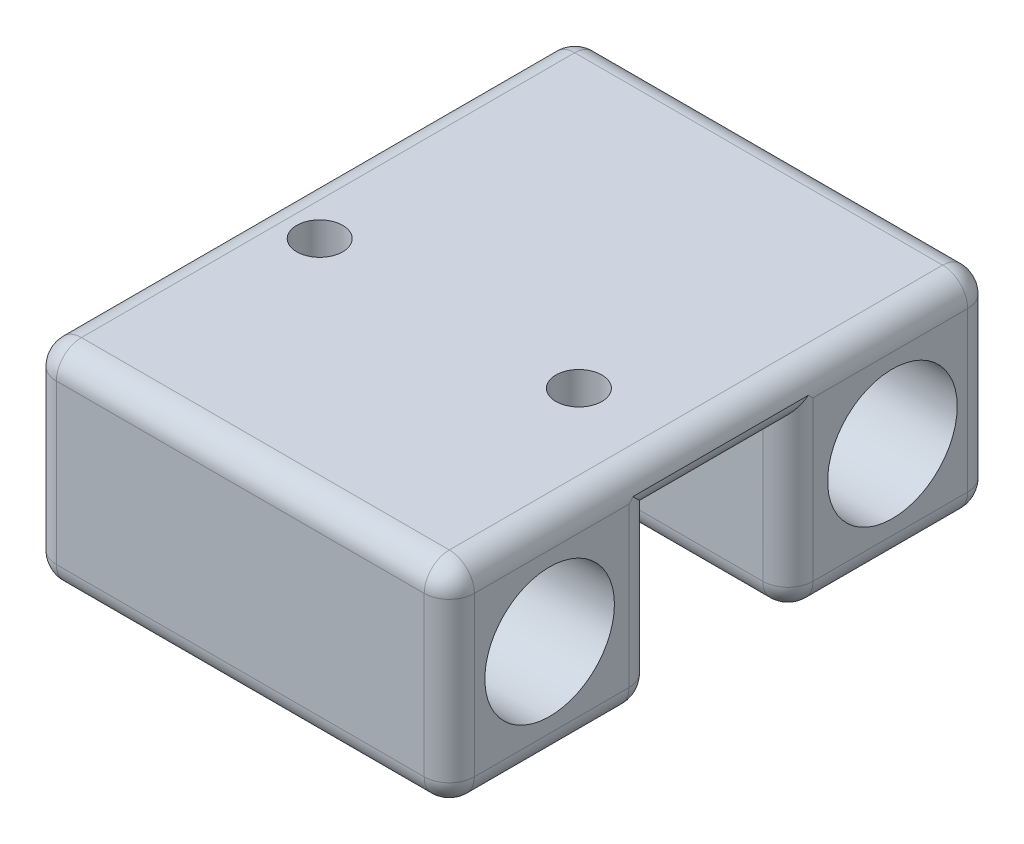
from build123d import *

# Parameters (mm, degrees)
SKETCH_1_W          = 50
SKETCH_1_H          = 65
EXTRUDE_1_DEPTH     = 25
SKETCH_2_R          = 7.75
SKETCH_2_W          = 16
SKETCH_2_H          = 21.892598188
CUT_EXTRUDE_1_DEPTH = 78.172355865
SKETCH_4_R          = 2.75
CUT_EXTRUDE_3_DEPTH = 5
FILLET_1_R          = 3


with BuildPart() as part:
    # 草图1 → 凸台-拉伸1 (new body)
    with BuildSketch(Plane(origin=(0, 0, 0), x_dir=(1, 0, 0), z_dir=(0, 1, 0))):
        with Locations((7.34375, -20.703125)):
            Rectangle(SKETCH_1_W, SKETCH_1_H)
    extrude(amount=EXTRUDE_1_DEPTH)

    # 草图2 → 切除-拉伸1 (cut, through all)
    with BuildSketch(Plane(origin=(32.34375, 0, 0), x_dir=(0, 0, -1), z_dir=(1, 0, 0))):
        with Locations((-41.203125, 12.5)):
            Circle(SKETCH_2_R)
        with Locations((-0.203125, 12.5)):
            Circle(SKETCH_2_R)
        with Locations((-20.703125, 9.053700906)):
            Rectangle(SKETCH_2_W, SKETCH_2_H)
    extrude(amount=-CUT_EXTRUDE_1_DEPTH, mode=Mode.SUBTRACT)

    # 草图4 → 切除-拉伸3 (cut)
    with BuildSketch(Plane(origin=(0, 25, 0), x_dir=(1, 0, 0), z_dir=(0, 1, 0))):
        with Locations(Location((20.34375, -25.703125, 0), (0, 0, 270))):
            Circle(SKETCH_4_R)
        with Locations(Location((-10.65625, -25.703125, 0), (0, 0, 270))):
            Circle(SKETCH_4_R)
    extrude(amount=-CUT_EXTRUDE_3_DEPTH, mode=Mode.SUBTRACT)

    # 圆角1
    # the kernel refuses this fillet: 3 mm, written as the material it takes off along each edge
    with BuildSketch(Plane(origin=(29.34375, 22, -8.796875), x_dir=(1, 0, 0), z_dir=(0, 0, -1))) as fillet_1_piece_1_section:
        Polygon((0, 0), (FILLET_1_R, 0), (FILLET_1_R, -FILLET_1_R), (0, -FILLET_1_R), align=None)
    fillet_1_piece_1 = extrude(amount=FILLET_1_R, mode=Mode.PRIVATE)
    fillet_1_piece_1 = fillet_1_piece_1 - Plane(origin=(29.34375, 22, -8.796875), x_dir=(-0.7071067811865475, -0.7071067811865475, 0), z_dir=(0, 0, -1)) * Sphere(FILLET_1_R, mode=Mode.PRIVATE)
    add(fillet_1_piece_1, mode=Mode.SUBTRACT)
    with BuildSketch(Plane(origin=(29.34375, 22, 50.203125), x_dir=(1, 0, 0), z_dir=(0, 0, 1))) as fillet_1_piece_2_section:
        Polygon((0, 0), (FILLET_1_R, 0), (FILLET_1_R, FILLET_1_R), (0, FILLET_1_R), align=None)
    fillet_1_piece_2 = extrude(amount=FILLET_1_R, mode=Mode.PRIVATE)
    fillet_1_piece_2 = fillet_1_piece_2 - Plane(origin=(29.34375, 22, 50.203125), x_dir=(-0.7071067811865475, -0.7071067811865475, 0), z_dir=(0, 0, 1)) * Sphere(FILLET_1_R, mode=Mode.PRIVATE)
    add(fillet_1_piece_2, mode=Mode.SUBTRACT)
    with BuildSketch(Plane(origin=(-14.65625, 22, -8.796875), x_dir=(-1, 0, 0), z_dir=(0, 0, -1))) as fillet_1_piece_3_section:
        Polygon((0, 0), (FILLET_1_R, 0), (FILLET_1_R, FILLET_1_R), (0, FILLET_1_R), align=None)
    fillet_1_piece_3 = extrude(amount=FILLET_1_R, mode=Mode.PRIVATE)
    fillet_1_piece_3 = fillet_1_piece_3 - Plane(origin=(-14.65625, 22, -8.796875), x_dir=(0.7071067811865475, -0.7071067811865475, 0), z_dir=(0, 0, -1)) * Sphere(FILLET_1_R, mode=Mode.PRIVATE)
    add(fillet_1_piece_3, mode=Mode.SUBTRACT)
    with BuildSketch(Plane(origin=(-14.65625, 3, 50.203125), x_dir=(0, -1, 0), z_dir=(-1, 0, 0))) as fillet_1_piece_4_section:
        Polygon((0, 0), (FILLET_1_R, 0), (FILLET_1_R, FILLET_1_R), (0, FILLET_1_R), align=None)
    fillet_1_piece_4 = extrude(amount=FILLET_1_R, mode=Mode.PRIVATE)
    fillet_1_piece_4 = fillet_1_piece_4 - Plane(origin=(-14.65625, 3, 50.203125), x_dir=(0, 0.7071067811865475, -0.7071067811865475), z_dir=(-1, 0, 0)) * Sphere(FILLET_1_R, mode=Mode.PRIVATE)
    add(fillet_1_piece_4, mode=Mode.SUBTRACT)
    with BuildSketch(Plane(origin=(-14.65625, 3, 31.703125), x_dir=(0, -1, 0), z_dir=(-1, 0, 0))) as fillet_1_piece_5_section:
        Polygon((0, 0), (FILLET_1_R, 0), (FILLET_1_R, -FILLET_1_R), (0, -FILLET_1_R), align=None)
    fillet_1_piece_5 = extrude(amount=FILLET_1_R, mode=Mode.PRIVATE)
    fillet_1_piece_5 = fillet_1_piece_5 - Plane(origin=(-14.65625, 3, 31.703125), x_dir=(0, 0.7071067811865475, 0.7071067811865475), z_dir=(-1, 0, 0)) * Sphere(FILLET_1_R, mode=Mode.PRIVATE)
    add(fillet_1_piece_5, mode=Mode.SUBTRACT)
    with BuildSketch(Plane(origin=(29.34375, 3, -8.796875), x_dir=(1, 0, 0), z_dir=(0, 0, -1))) as fillet_1_piece_6_section:
        Polygon((0, 0), (FILLET_1_R, 0), (FILLET_1_R, FILLET_1_R), (0, FILLET_1_R), align=None)
    fillet_1_piece_6 = extrude(amount=FILLET_1_R, mode=Mode.PRIVATE)
    fillet_1_piece_6 = fillet_1_piece_6 - Plane(origin=(29.34375, 3, -8.796875), x_dir=(-0.7071067811865475, 0.7071067811865475, 0), z_dir=(0, 0, -1)) * Sphere(FILLET_1_R, mode=Mode.PRIVATE)
    add(fillet_1_piece_6, mode=Mode.SUBTRACT)
    with BuildSketch(Plane(origin=(29.34375, 3, 9.703125), x_dir=(1, 0, 0), z_dir=(0, 0, 1))) as fillet_1_piece_7_section:
        Polygon((0, 0), (FILLET_1_R, 0), (FILLET_1_R, -FILLET_1_R), (0, -FILLET_1_R), align=None)
    fillet_1_piece_7 = extrude(amount=FILLET_1_R, mode=Mode.PRIVATE)
    fillet_1_piece_7 = fillet_1_piece_7 - Plane(origin=(29.34375, 3, 9.703125), x_dir=(-0.7071067811865475, 0.7071067811865475, 0), z_dir=(0, 0, 1)) * Sphere(FILLET_1_R, mode=Mode.PRIVATE)
    add(fillet_1_piece_7, mode=Mode.SUBTRACT)
    with BuildSketch(Plane(origin=(29.34375, 3, 31.703125), x_dir=(0, -1, 0), z_dir=(1, 0, 0))) as fillet_1_piece_8_section:
        Polygon((0, 0), (FILLET_1_R, 0), (FILLET_1_R, FILLET_1_R), (0, FILLET_1_R), align=None)
    fillet_1_piece_8 = extrude(amount=FILLET_1_R, mode=Mode.PRIVATE)
    fillet_1_piece_8 = fillet_1_piece_8 - Plane(origin=(29.34375, 3, 31.703125), x_dir=(0, 0.7071067811865475, 0.7071067811865475), z_dir=(1, 0, 0)) * Sphere(FILLET_1_R, mode=Mode.PRIVATE)
    add(fillet_1_piece_8, mode=Mode.SUBTRACT)
    with BuildSketch(Plane(origin=(-14.65625, 3, 9.703125), x_dir=(-1, 0, 0), z_dir=(0, 0, 1))) as fillet_1_piece_9_section:
        Polygon((0, 0), (FILLET_1_R, 0), (FILLET_1_R, FILLET_1_R), (0, FILLET_1_R), align=None)
    fillet_1_piece_9 = extrude(amount=FILLET_1_R, mode=Mode.PRIVATE)
    fillet_1_piece_9 = fillet_1_piece_9 - Plane(origin=(-14.65625, 3, 9.703125), x_dir=(0.7071067811865475, 0.7071067811865475, 0), z_dir=(0, 0, 1)) * Sphere(FILLET_1_R, mode=Mode.PRIVATE)
    add(fillet_1_piece_9, mode=Mode.SUBTRACT)
    with BuildSketch(Plane(origin=(-14.65625, 22, 50.203125), x_dir=(0, 1, 0), z_dir=(-1, 0, 0))) as fillet_1_piece_10_section:
        Polygon((0, 0), (FILLET_1_R, 0), (FILLET_1_R, -FILLET_1_R), (0, -FILLET_1_R), align=None)
    fillet_1_piece_10 = extrude(amount=FILLET_1_R, mode=Mode.PRIVATE)
    fillet_1_piece_10 = fillet_1_piece_10 - Plane(origin=(-14.65625, 22, 50.203125), x_dir=(0, -0.7071067811865475, -0.7071067811865475), z_dir=(-1, 0, 0)) * Sphere(FILLET_1_R, mode=Mode.PRIVATE)
    add(fillet_1_piece_10, mode=Mode.SUBTRACT)
    with BuildSketch(Plane(origin=(-14.65625, 3, -8.796875), x_dir=(-1, 0, 0), z_dir=(0, 0, -1))) as fillet_1_piece_11_section:
        Polygon((0, 0), (FILLET_1_R, 0), (FILLET_1_R, -FILLET_1_R), (0, -FILLET_1_R), align=None)
    fillet_1_piece_11 = extrude(amount=FILLET_1_R, mode=Mode.PRIVATE)
    fillet_1_piece_11 = fillet_1_piece_11 - Plane(origin=(-14.65625, 3, -8.796875), x_dir=(0.7071067811865475, 0.7071067811865475, 0), z_dir=(0, 0, -1)) * Sphere(FILLET_1_R, mode=Mode.PRIVATE)
    add(fillet_1_piece_11, mode=Mode.SUBTRACT)
    with BuildSketch(Plane(origin=(29.34375, 3, 50.203125), x_dir=(1, 0, 0), z_dir=(0, 0, 1))) as fillet_1_piece_12_section:
        Polygon((0, 0), (FILLET_1_R, 0), (FILLET_1_R, -FILLET_1_R), (0, -FILLET_1_R), align=None)
    fillet_1_piece_12 = extrude(amount=FILLET_1_R, mode=Mode.PRIVATE)
    fillet_1_piece_12 = fillet_1_piece_12 - Plane(origin=(29.34375, 3, 50.203125), x_dir=(-0.7071067811865475, 0.7071067811865475, 0), z_dir=(0, 0, 1)) * Sphere(FILLET_1_R, mode=Mode.PRIVATE)
    add(fillet_1_piece_12, mode=Mode.SUBTRACT)
    with BuildSketch(Plane(origin=(32.34375, 25, -8.796875), x_dir=(0, -1, 0), z_dir=(0, 0, 1)), Plane(origin=(-17.65625, 25, 50.203125), x_dir=(0, -1, 0), z_dir=(0, 0, -1))) as fillet_1_piece_13:
        with BuildLine():
            CenterArc((FILLET_1_R, -FILLET_1_R), FILLET_1_R, 90, 90)
            Line((0, -FILLET_1_R), (0, 0))
            Line((0, 0), (FILLET_1_R, 0))
        make_face()
    extrude(amount=59, mode=Mode.SUBTRACT)
    with BuildSketch(Plane(origin=(-14.65625, 25, -11.796875), x_dir=(0, -1, 0), z_dir=(1, 0, 0)), Plane(origin=(-14.65625, 0, 28.703125), x_dir=(0, 0, 1), z_dir=(1, 0, 0)), Plane(origin=(29.34375, 0, 12.703125), x_dir=(0, 0, -1), z_dir=(-1, 0, 0)), Plane(origin=(29.34375, 0, 53.203125), x_dir=(0, 0, -1), z_dir=(-1, 0, 0))) as fillet_1_piece_14:
        with BuildLine():
            CenterArc((FILLET_1_R, -FILLET_1_R), FILLET_1_R, 90, 90)
            Line((0, -FILLET_1_R), (0, 0))
            Line((0, 0), (FILLET_1_R, 0))
        make_face()
    extrude(amount=44, mode=Mode.SUBTRACT)
    with BuildSketch(Plane(origin=(-17.65625, 0, 50.203125), x_dir=(0, 1, 0), z_dir=(0, 0, -1)), Plane(origin=(32.34375, 0, -8.796875), x_dir=(0, 1, 0), z_dir=(0, 0, 1)), Plane(origin=(32.34375, 0, 31.703125), x_dir=(0, 1, 0), z_dir=(0, 0, 1)), Plane(origin=(-17.65625, 0, 9.703125), x_dir=(0, 1, 0), z_dir=(0, 0, -1))) as fillet_1_piece_15:
        with BuildLine():
            CenterArc((FILLET_1_R, FILLET_1_R), FILLET_1_R, 180, 90)
            Line((0, FILLET_1_R), (0, 0))
            Line((0, 0), (FILLET_1_R, 0))
        make_face()
    extrude(amount=18.5, mode=Mode.SUBTRACT)
    with BuildSketch(Plane(origin=(-17.65625, 3, 12.703125), x_dir=(0, 0, -1), z_dir=(0, 1, 0)), Plane(origin=(-17.65625, 20, 28.703125), x_dir=(0, 0, 1), z_dir=(0, -1, 0)), Plane(origin=(32.34375, 3, 28.703125), x_dir=(0, 0, 1), z_dir=(0, 1, 0)), Plane(origin=(32.34375, 20, 12.703125), x_dir=(0, 0, -1), z_dir=(0, -1, 0))) as fillet_1_piece_16:
        with BuildLine():
            CenterArc((FILLET_1_R, -FILLET_1_R), FILLET_1_R, 90, 90)
            Line((0, -FILLET_1_R), (0, 0))
            Line((0, 0), (FILLET_1_R, 0))
        make_face()
    extrude(amount=17, mode=Mode.SUBTRACT)
    with BuildSketch(Plane(origin=(32.34375, 20, 28.703125), x_dir=(0, 1, 0), z_dir=(0, 0, -1)), Plane(origin=(-17.65625, 20, 12.703125), x_dir=(0, 1, 0), z_dir=(0, 0, 1))) as fillet_1_piece_17:
        with BuildLine():
            CenterArc((FILLET_1_R, -FILLET_1_R), FILLET_1_R, 90, 90)
            Line((0, -FILLET_1_R), (0, 0))
            Line((0, 0), (FILLET_1_R, 0))
        make_face()
    extrude(amount=16, mode=Mode.SUBTRACT)
    with BuildSketch(Plane(origin=(-14.65625, 0, -11.796875), x_dir=(0, 1, 0), z_dir=(1, 0, 0)), Plane(origin=(29.34375, 25, 53.203125), x_dir=(0, 0, -1), z_dir=(-1, 0, 0))) as fillet_1_piece_18:
        with BuildLine():
            CenterArc((FILLET_1_R, FILLET_1_R), FILLET_1_R, 180, 90)
            Line((0, FILLET_1_R), (0, 0))
            Line((0, 0), (FILLET_1_R, 0))
        make_face()
    extrude(amount=44, mode=Mode.SUBTRACT)
    with BuildSketch(Plane(origin=(-17.65625, 3, -11.796875), x_dir=(1, 0, 0), z_dir=(0, 1, 0)), Plane(origin=(-17.65625, 3, 53.203125), x_dir=(0, 0, -1), z_dir=(0, 1, 0))) as fillet_1_piece_19:
        with BuildLine():
            CenterArc((FILLET_1_R, -FILLET_1_R), FILLET_1_R, 90, 90)
            Line((0, -FILLET_1_R), (0, 0))
            Line((0, 0), (FILLET_1_R, 0))
        make_face()
    extrude(amount=19, mode=Mode.SUBTRACT)
    with BuildSketch(Plane(origin=(32.34375, 3, -11.796875), x_dir=(-1, 0, 0), z_dir=(0, 1, 0)), Plane(origin=(32.34375, 3, 53.203125), x_dir=(0, 0, -1), z_dir=(0, 1, 0))) as fillet_1_piece_20:
        with BuildLine():
            CenterArc((FILLET_1_R, FILLET_1_R), FILLET_1_R, 180, 90)
            Line((0, FILLET_1_R), (0, 0))
            Line((0, 0), (FILLET_1_R, 0))
        make_face()
    extrude(amount=19, mode=Mode.SUBTRACT)
    with BuildSketch(Plane(origin=(-17.65625, 20, 5.203125), x_dir=(0, 1, 0), z_dir=(0, 0, 1))) as fillet_1_piece_21a_section:
        with BuildLine():
            CenterArc((FILLET_1_R, -FILLET_1_R), FILLET_1_R, 90, 90)
            Line((0, -FILLET_1_R), (0, 0))
            Line((0, 0), (FILLET_1_R, 0))
        make_face()
    fillet_1_piece_21a = extrude(amount=23.5, mode=Mode.PRIVATE)
    fillet_1_piece_21a = split(fillet_1_piece_21a, bisect_by=Plane(origin=(-16.977064657, 20.679185343, 12.703125), z_dir=(0, 0, -1)), keep=Keep.TOP, mode=Mode.PRIVATE)
    with BuildSketch(Plane(origin=(-17.65625, 3, 12.703125), x_dir=(0, 0, -1), z_dir=(0, 1, 0))) as fillet_1_piece_21b_section:
        with BuildLine():
            CenterArc((FILLET_1_R, -FILLET_1_R), FILLET_1_R, 90, 90)
            Line((0, -FILLET_1_R), (0, 0))
            Line((0, 0), (FILLET_1_R, 0))
        make_face()
    fillet_1_piece_21b = extrude(amount=24.5, mode=Mode.PRIVATE)
    fillet_1_piece_21b = split(fillet_1_piece_21b, bisect_by=Plane(origin=(-16.977064657, 20, 12.023939657), z_dir=(0, 1, 0)), keep=Keep.TOP, mode=Mode.PRIVATE)
    fillet_1_piece_21 = fillet_1_piece_21a & fillet_1_piece_21b
    add(fillet_1_piece_21, mode=Mode.SUBTRACT)
    with BuildSketch(Plane(origin=(-17.65625, 27.5, 28.703125), x_dir=(0, 0, 1), z_dir=(0, -1, 0))) as fillet_1_piece_22a_section:
        with BuildLine():
            CenterArc((FILLET_1_R, -FILLET_1_R), FILLET_1_R, 90, 90)
            Line((0, -FILLET_1_R), (0, 0))
            Line((0, 0), (FILLET_1_R, 0))
        make_face()
    fillet_1_piece_22a = extrude(amount=24.5, mode=Mode.PRIVATE)
    fillet_1_piece_22a = split(fillet_1_piece_22a, bisect_by=Plane(origin=(-16.977064657, 20, 29.382310343), z_dir=(0, 1, 0)), keep=Keep.TOP, mode=Mode.PRIVATE)
    with BuildSketch(Plane(origin=(-17.65625, 20, 12.703125), x_dir=(0, 1, 0), z_dir=(0, 0, 1))) as fillet_1_piece_22b_section:
        with BuildLine():
            CenterArc((FILLET_1_R, -FILLET_1_R), FILLET_1_R, 90, 90)
            Line((0, -FILLET_1_R), (0, 0))
            Line((0, 0), (FILLET_1_R, 0))
        make_face()
    fillet_1_piece_22b = extrude(amount=23.5, mode=Mode.PRIVATE)
    fillet_1_piece_22b = split(fillet_1_piece_22b, bisect_by=Plane(origin=(-16.977064657, 20.679185343, 28.703125), z_dir=(0, 0, 1)), keep=Keep.TOP, mode=Mode.PRIVATE)
    fillet_1_piece_22 = fillet_1_piece_22a & fillet_1_piece_22b
    add(fillet_1_piece_22, mode=Mode.SUBTRACT)
    with BuildSketch(Plane(origin=(32.34375, 20, 36.203125), x_dir=(0, 1, 0), z_dir=(0, 0, -1))) as fillet_1_piece_23a_section:
        with BuildLine():
            CenterArc((FILLET_1_R, -FILLET_1_R), FILLET_1_R, 90, 90)
            Line((0, -FILLET_1_R), (0, 0))
            Line((0, 0), (FILLET_1_R, 0))
        make_face()
    fillet_1_piece_23a = extrude(amount=23.5, mode=Mode.PRIVATE)
    fillet_1_piece_23a = split(fillet_1_piece_23a, bisect_by=Plane(origin=(31.664564657, 20.679185343, 28.703125), z_dir=(0, 0, 1)), keep=Keep.TOP, mode=Mode.PRIVATE)
    with BuildSketch(Plane(origin=(32.34375, 3, 28.703125), x_dir=(0, 0, 1), z_dir=(0, 1, 0))) as fillet_1_piece_23b_section:
        with BuildLine():
            CenterArc((FILLET_1_R, -FILLET_1_R), FILLET_1_R, 90, 90)
            Line((0, -FILLET_1_R), (0, 0))
            Line((0, 0), (FILLET_1_R, 0))
        make_face()
    fillet_1_piece_23b = extrude(amount=24.5, mode=Mode.PRIVATE)
    fillet_1_piece_23b = split(fillet_1_piece_23b, bisect_by=Plane(origin=(31.664564657, 20, 29.382310343), z_dir=(0, 1, 0)), keep=Keep.TOP, mode=Mode.PRIVATE)
    fillet_1_piece_23 = fillet_1_piece_23a & fillet_1_piece_23b
    add(fillet_1_piece_23, mode=Mode.SUBTRACT)
    with BuildSketch(Plane(origin=(32.34375, 27.5, 12.703125), x_dir=(0, 0, -1), z_dir=(0, -1, 0))) as fillet_1_piece_24a_section:
        with BuildLine():
            CenterArc((FILLET_1_R, -FILLET_1_R), FILLET_1_R, 90, 90)
            Line((0, -FILLET_1_R), (0, 0))
            Line((0, 0), (FILLET_1_R, 0))
        make_face()
    fillet_1_piece_24a = extrude(amount=24.5, mode=Mode.PRIVATE)
    fillet_1_piece_24a = split(fillet_1_piece_24a, bisect_by=Plane(origin=(31.664564657, 20, 12.023939657), z_dir=(0, 1, 0)), keep=Keep.TOP, mode=Mode.PRIVATE)
    with BuildSketch(Plane(origin=(32.34375, 20, 28.703125), x_dir=(0, 1, 0), z_dir=(0, 0, -1))) as fillet_1_piece_24b_section:
        with BuildLine():
            CenterArc((FILLET_1_R, -FILLET_1_R), FILLET_1_R, 90, 90)
            Line((0, -FILLET_1_R), (0, 0))
            Line((0, 0), (FILLET_1_R, 0))
        make_face()
    fillet_1_piece_24b = extrude(amount=23.5, mode=Mode.PRIVATE)
    fillet_1_piece_24b = split(fillet_1_piece_24b, bisect_by=Plane(origin=(31.664564657, 20.679185343, 12.703125), z_dir=(0, 0, -1)), keep=Keep.TOP, mode=Mode.PRIVATE)
    fillet_1_piece_24 = fillet_1_piece_24a & fillet_1_piece_24b
    add(fillet_1_piece_24, mode=Mode.SUBTRACT)


solid = part.part
